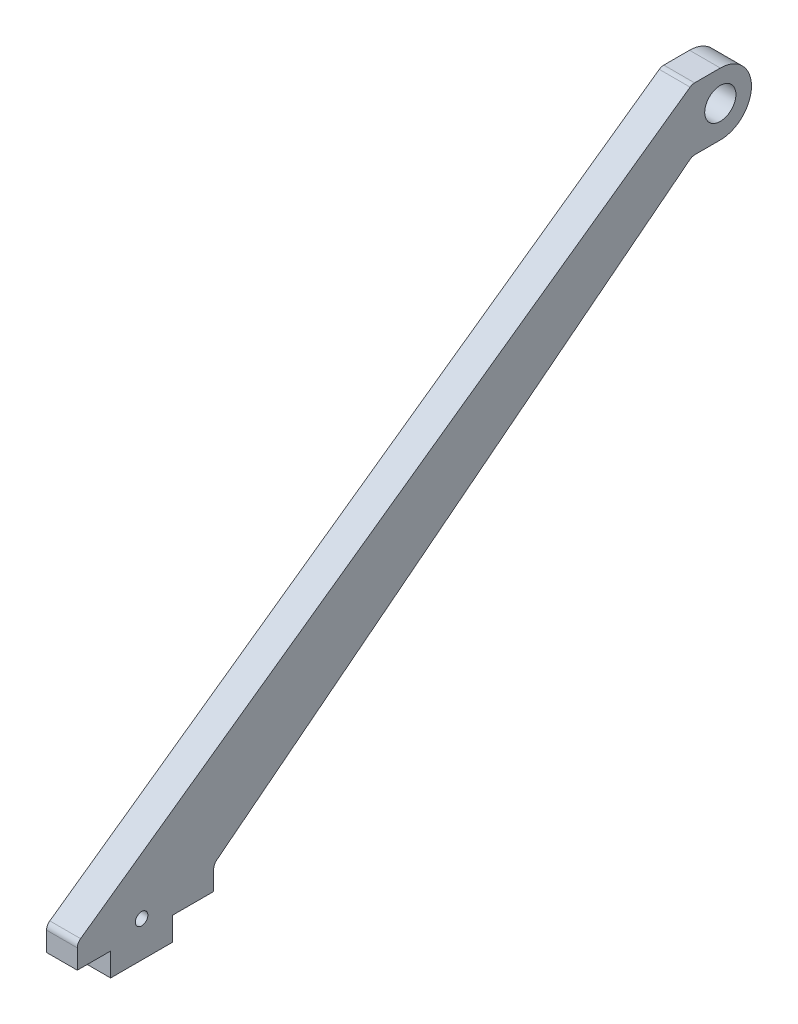
from build123d import *

# Parameters (mm, degrees)
BOSS_EXTRU_1_DEPTH      = 7.9
ESQUISSE2_R             = 1.6
ESQUISSE2_R_2           = 4
ENL_V_MAT_EXTRU_1_DEPTH = 239.020370659
CONG_1_R                = 2


with BuildPart() as part:
    # Esquisse1 → Boss.-Extru.1 (new body)
    with BuildSketch(Plane(origin=(0, 0, 0), x_dir=(0, 0, -1), z_dir=(1, 0, 0))):
        with BuildLine():
            Line((37.960924758, 0.984416578), (37.960924758, 6.984416578))
            Line((37.960924758, 6.984416578), (29.410924758, 6.984416578))
            Line((29.410924758, 6.984416578), (29.410924758, 12.984416578))
            Line((29.410924758, 12.984416578), (187.175507503, 124.984416578))
            Line((187.175507503, 124.984416578), (194.410924758, 124.984416578))
            ThreePointArc((194.410924758, 124.984416578), (202.410924758, 116.984416578), (194.410924758, 108.984416578))
            Line((194.410924758, 108.984416578), (187.175507503, 108.984416578))
            Line((187.175507503, 108.984416578), (64.410924758, 12.984416578))
            Line((64.410924758, 12.984416578), (64.410924758, 6.984416578))
            Line((64.410924758, 6.984416578), (53.860924758, 6.984416578))
            Line((53.860924758, 6.984416578), (53.860924758, 0.984416578))
            Line((53.860924758, 0.984416578), (37.960924758, 0.984416578))
        make_face()
    extrude(amount=BOSS_EXTRU_1_DEPTH)

    # Esquisse2 → Enlèv. mat.-Extru.1 (cut, through all)
    with BuildSketch(Plane(origin=(7.9, 0, 0), x_dir=(0, 0, -1), z_dir=(1, 0, 0))):
        with Locations((45.910924758, 10.184416578)):
            Circle(ESQUISSE2_R)
        with Locations((194.410924758, 117.118890011)):
            Circle(ESQUISSE2_R_2)
    extrude(amount=-ENL_V_MAT_EXTRU_1_DEPTH, mode=Mode.SUBTRACT)

    # Congé1
    cong_1_edges = [part.edges().sort_by_distance(p)[0] for p in [
        (3.95, 12.984416578, -29.410924758),
        (3.95, 12.984416578, -64.410924758),
        (3.95, 108.984416578, -187.175507503),
        (3.95, 124.984416578, -187.175507503),
    ]]
    fillet(cong_1_edges, radius=CONG_1_R)


solid = part.part
